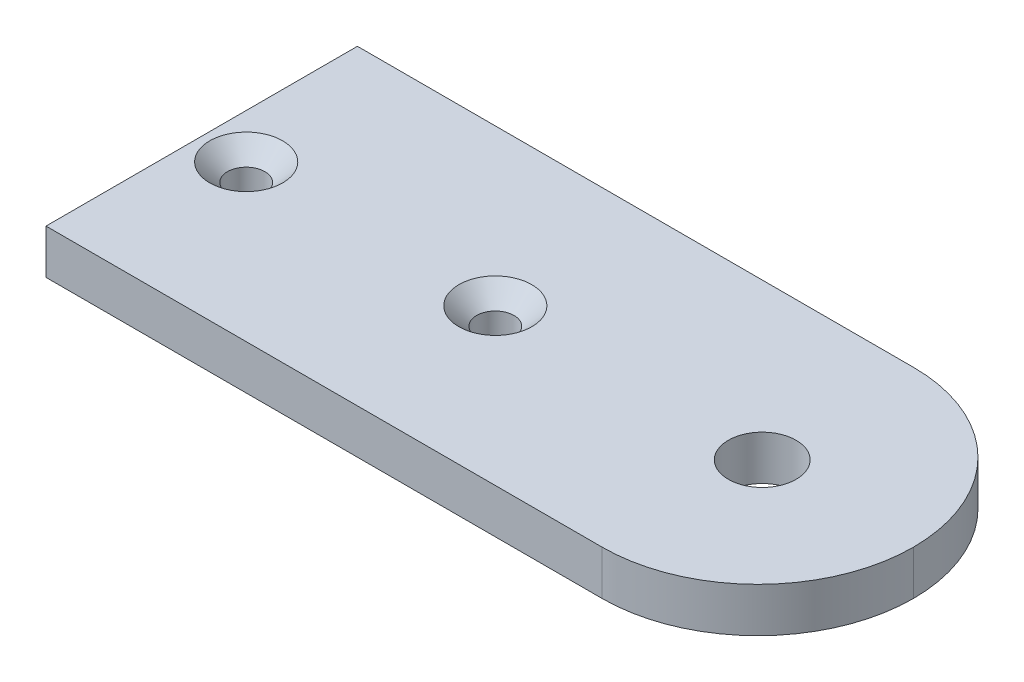
from build123d import *

# Parameters (mm, degrees)
SKETCH1_W                                         = 80
SKETCH1_H                                         = 35
BOSS_EXTRUDE1_DEPTH                               = 5
CSK_FOR_M3_5_FLAT_HEAD_MACHINE_SCREW1_D           = 4.2
CSK_FOR_M3_5_FLAT_HEAD_MACHINE_SCREW1_CSINK_D     = 8.2
CSK_FOR_M3_5_FLAT_HEAD_MACHINE_SCREW1_CSINK_ANGLE = 90
SKETCH5_R                                         = 3.81
CUT_EXTRUDE1_DEPTH                                = 5
FILLET1_R                                         = 17.5


with BuildPart() as part:
    # Sketch1 → Boss-Extrude1 (new body)
    with BuildSketch(Plane(origin=(0, 0, 0), x_dir=(1, 0, 0), z_dir=(0, 1, 0))):
        with Locations((40, -17.5)):
            Rectangle(SKETCH1_W, SKETCH1_H)
    extrude(amount=BOSS_EXTRUDE1_DEPTH)

    # CSK for M3.5 Flat Head Machine Screw1 (through all)
    with Locations(Plane(origin=(0, 5, 0), x_dir=(1, 0, 0), z_dir=(0, 1, 0))):
        with Locations((33, -17.5), (5, -17.5)):
            CounterSinkHole(CSK_FOR_M3_5_FLAT_HEAD_MACHINE_SCREW1_D / 2, CSK_FOR_M3_5_FLAT_HEAD_MACHINE_SCREW1_CSINK_D / 2, counter_sink_angle=CSK_FOR_M3_5_FLAT_HEAD_MACHINE_SCREW1_CSINK_ANGLE)

    # Sketch5 → Cut-Extrude1 (cut)
    with BuildSketch(Plane.XZ):
        with Locations(Location((63, 17.5, 0), (0, 0, 270))):
            Circle(SKETCH5_R)
    extrude(amount=-CUT_EXTRUDE1_DEPTH, mode=Mode.SUBTRACT)

    # Fillet1
    fillet1_edges = [part.edges().sort_by_distance(p)[0] for p in [
        (80, 2.5, 35),
        (80, 2.5, 0),
    ]]
    fillet(fillet1_edges, radius=FILLET1_R - 0.0001)  # a hair under: the kernel refuses the full size


solid = part.part
